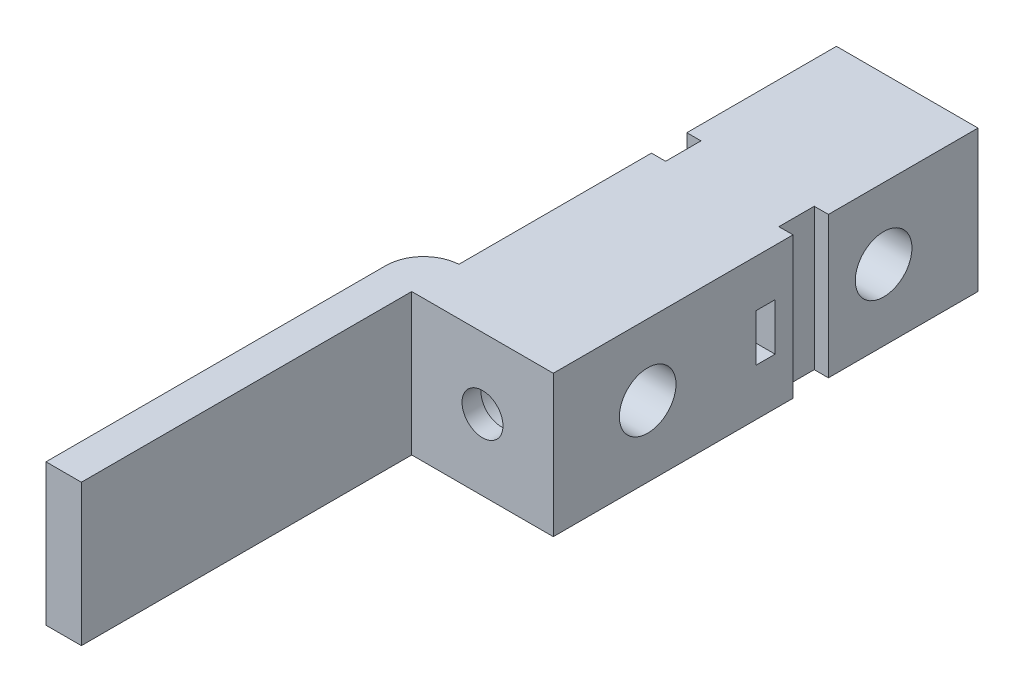
from build123d import *

# Parameters (mm, degrees)
SKETCH1_W           = 19.05
SKETCH1_H           = 19.05
BOSS_EXTRUDE1_DEPTH = 57.15
SKETCH2_R           = 2.7559
CUT_EXTRUDE1_DEPTH  = 57.15
SKETCH3_R           = 4.445
CUT_EXTRUDE2_DEPTH  = 54.61
SKETCH4_R           = 3.81
CUT_EXTRUDE3_DEPTH  = 54.61
SKETCH6_W           = 2.54
SKETCH6_H           = 6.35
CUT_EXTRUDE4_DEPTH  = 54.61
SKETCH7_W           = 1.905
SKETCH7_H           = 4.7625
CUT_EXTRUDE5_DEPTH  = 54.61
SKETCH8_W           = 6.35
SKETCH8_H           = 19.05
SKETCH8_W_2         = 44.45
BOSS_EXTRUDE2_DEPTH = 4.7625
FILLET2_R           = 5.08


with BuildPart() as part:
    # Sketch1 → Boss-Extrude1 (new body)
    with BuildSketch(Plane.XY):
        Rectangle(SKETCH1_W, SKETCH1_H)
    extrude(amount=BOSS_EXTRUDE1_DEPTH)

    # Sketch2 → Cut-Extrude1 (cut)
    with BuildSketch(Plane(origin=(0, 0, 0), x_dir=(-1, 0, 0), z_dir=(0, 0, -1))):
        Circle(SKETCH2_R)
    extrude(amount=-CUT_EXTRUDE1_DEPTH, mode=Mode.SUBTRACT)

    # Sketch3 → Cut-Extrude2 (cut)
    with BuildSketch(Plane(origin=(0, 0, 0), x_dir=(-1, 0, 0), z_dir=(0, 0, -1))):
        Circle(SKETCH3_R)
    extrude(amount=-CUT_EXTRUDE2_DEPTH, mode=Mode.SUBTRACT)

    # Sketch4 → Cut-Extrude3 (cut)
    with BuildSketch(Plane(origin=(9.525, 0, 0), x_dir=(0, 0, -1), z_dir=(1, 0, 0))):
        with Locations((-44.45, 0)):
            Circle(SKETCH4_R)
        with Locations((-12.7, 0)):
            Circle(SKETCH4_R)
    extrude(amount=-CUT_EXTRUDE3_DEPTH, mode=Mode.SUBTRACT)

    # Sketch6 → Cut-Extrude4 (cut)
    with BuildSketch(Plane(origin=(9.525, 0, 0), x_dir=(0, 0, -1), z_dir=(1, 0, 0))):
        with Locations((-28.575, 0)):
            Rectangle(SKETCH6_W, SKETCH6_H)
    extrude(amount=-CUT_EXTRUDE4_DEPTH, mode=Mode.SUBTRACT)

    # Sketch7 → Cut-Extrude5 (cut)
    with BuildSketch(Plane.XZ.offset(9.525)):
        with Locations((-8.5725, 22.51075)):
            Rectangle(SKETCH7_W, SKETCH7_H)
        with Locations((8.5725, 22.51075)):
            Rectangle(SKETCH7_W, SKETCH7_H)
    extrude(amount=-CUT_EXTRUDE5_DEPTH, mode=Mode.SUBTRACT)

    # Sketch8 → Boss-Extrude2 (add)
    with BuildSketch(Plane.ZY.offset(9.525)):
        with Locations((53.975, 0)):
            Rectangle(SKETCH8_W, SKETCH8_H)
        with Locations((79.375, 0)):
            Rectangle(SKETCH8_W_2, SKETCH8_H)
    extrude(amount=BOSS_EXTRUDE2_DEPTH)

    # Fillet2
    # the kernel refuses this fillet: 5.08 mm, written as the material it takes off along each edge
    with BuildSketch(Plane(origin=(-14.2875, 22.200171042, 50.8), x_dir=(1, 0, 0), z_dir=(0, -1, 0))) as fillet2_piece_1:
        with BuildLine():
            CenterArc((5.08, 5.070068417), FILLET2_R, 180, 86.416678302)
            Line((0, 5.070068417), (-0.1016, 5.070068417))
            Line((-0.1016, 5.070068417), (-0.1016, 0))
            Line((-0.1016, 0), (0, -0.1016))
            ThreePointArc((0, -0.1016), (2.38125, -0.1016), (4.75615, -0.101401368))
            Line((4.75615, -0.101401368), (4.7625, 0))
        make_face()
    extrude(amount=44.400342083, mode=Mode.SUBTRACT)


solid = part.part
